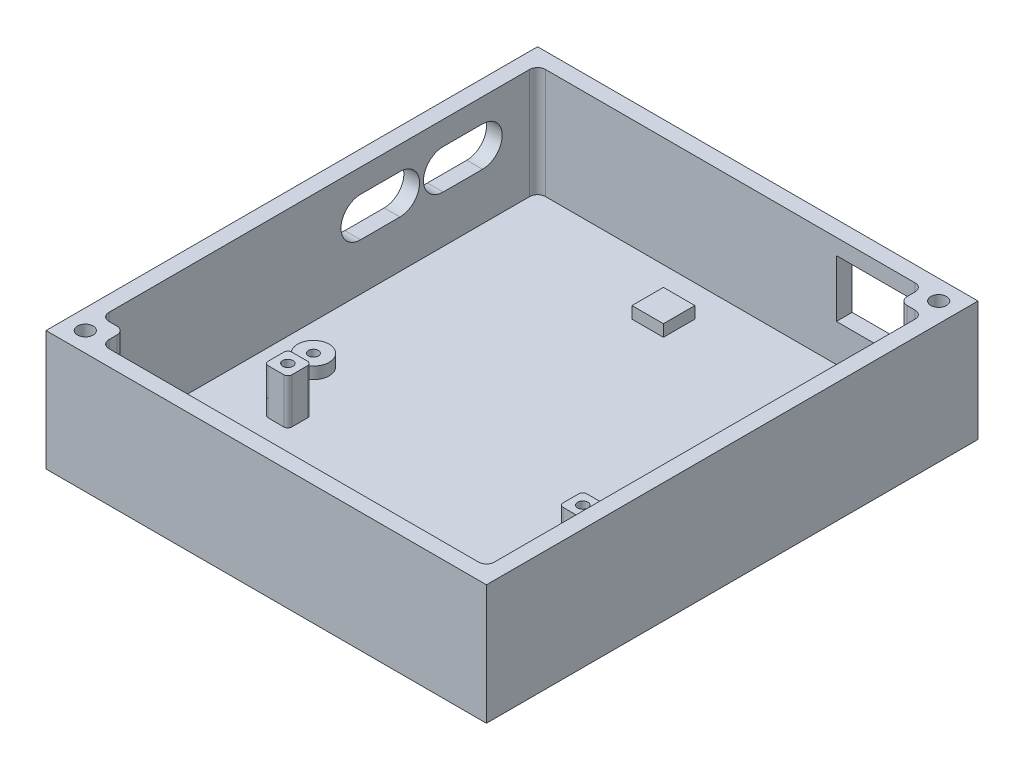
from build123d import *

# Parameters (mm, degrees)
SKETCH1_W           = 112
SKETCH1_H           = 125
BOSS_EXTRUDE1_DEPTH = 2.5
SKETCH2_W           = 112
SKETCH2_H           = 125
SKETCH2_R           = 2
BOSS_EXTRUDE2_DEPTH = 10
SKETCH3_W           = 6
SKETCH3_H           = 6
SKETCH3_R           = 1.3
BOSS_EXTRUDE3_DEPTH = 11.5
SKETCH5_R           = 4
SKETCH5_R_2         = 1.25
SKETCH5_W           = 8
SKETCH5_H           = 8
BOSS_EXTRUDE4_DEPTH = 3
SKETCH6_W           = 6
SKETCH6_H           = 6
SKETCH6_R           = 1.3
BOSS_EXTRUDE5_DEPTH = 6.3
SKETCH7_W           = 112
SKETCH7_H           = 125
SKETCH7_R           = 2
BOSS_EXTRUDE6_DEPTH = 18
CUT_EXTRUDE1_REACH  = 133.835
CUT_EXTRUDE2_REACH  = 142.326
SKETCH10_W          = 18
SKETCH10_H          = 14.5
FILLET1_R           = 2
FILLET3_R           = 1


with BuildPart() as part:
    # Sketch1 → Boss-Extrude1 (new body)
    with BuildSketch(Plane(origin=(0, 0, 0), x_dir=(1, 0, 0), z_dir=(0, 1, 0))):
        Rectangle(SKETCH1_W, SKETCH1_H)
    extrude(amount=BOSS_EXTRUDE1_DEPTH)

    # Sketch2 → Boss-Extrude2 (add)
    with BuildSketch(Plane(origin=(0, 2.5, 0), x_dir=(1, 0, 0), z_dir=(0, 1, 0))):
        Rectangle(SKETCH2_W, SKETCH2_H)
        Polygon((46, 52.5), (52, 52.5), (52, -58.5), (-46, -58.5), (-46, -52.5), (-52, -52.5), (-52, 58.5), (46, 58.5), align=None, mode=Mode.SUBTRACT)
        with Locations((51, 57.5)):
            Circle(SKETCH2_R, mode=Mode.SUBTRACT)
        with Locations((-51, -57.5)):
            Circle(SKETCH2_R, mode=Mode.SUBTRACT)
    extrude(amount=BOSS_EXTRUDE2_DEPTH)

    # Sketch3 → Boss-Extrude3 (add)
    # profile 1 of 4: a face of its own
    with BuildSketch(Plane(origin=(0, 2.5, 0), x_dir=(1, 0, 0), z_dir=(0, 1, 0))):
        with Locations((-34.5, -22.5)):
            Rectangle(SKETCH3_W, SKETCH3_H)
        with Locations((-34.5, -22.5)):
            Circle(SKETCH3_R, mode=Mode.SUBTRACT)
    # profile 2 of 4: a face of its own
    with BuildSketch(Plane(origin=(0, 2.5, 0), x_dir=(1, 0, 0), z_dir=(0, 1, 0))):
        with Locations((40.5, -22.5)):
            Rectangle(SKETCH3_W, SKETCH3_H)
        with Locations((40.5, -22.5)):
            Circle(SKETCH3_R, mode=Mode.SUBTRACT)
    # profile 3 of 4: a face of its own
    with BuildSketch(Plane(origin=(0, 2.5, 0), x_dir=(1, 0, 0), z_dir=(0, 1, 0))):
        with Locations((-34.5, -53.5)):
            Rectangle(SKETCH3_W, SKETCH3_H)
        with Locations((-34.5, -53.5)):
            Circle(SKETCH3_R, mode=Mode.SUBTRACT)
    # profile 4 of 4: a face of its own
    with BuildSketch(Plane(origin=(0, 2.5, 0), x_dir=(1, 0, 0), z_dir=(0, 1, 0))):
        with Locations((40.5, -53.5)):
            Rectangle(SKETCH3_W, SKETCH3_H)
        with Locations((40.5, -53.5)):
            Circle(SKETCH3_R, mode=Mode.SUBTRACT)
    extrude(amount=BOSS_EXTRUDE3_DEPTH)

    # Sketch5 → Boss-Extrude4 (add)
    # profile 1 of 3: a face of its own
    with BuildSketch(Plane(origin=(0, 2.5, 0), x_dir=(1, 0, 0), z_dir=(0, 1, 0))):
        with Locations((-42, -8.5)):
            Circle(SKETCH5_R)
        with Locations((-42, -8.5)):
            Circle(SKETCH5_R_2, mode=Mode.SUBTRACT)
    # profile 2 of 3: a face of its own
    with BuildSketch(Plane(origin=(0, 2.5, 0), x_dir=(1, 0, 0), z_dir=(0, 1, 0))):
        with Locations((38, -8.5)):
            Circle(SKETCH5_R)
        with Locations((38, -8.5)):
            Circle(SKETCH5_R_2, mode=Mode.SUBTRACT)
    # profile 3 of 3: a face of its own
    with BuildSketch(Plane(origin=(0, 2.5, 0), x_dir=(1, 0, 0), z_dir=(0, 1, 0))):
        with Locations((-8, 46.5)):
            Rectangle(SKETCH5_W, SKETCH5_H)
    extrude(amount=BOSS_EXTRUDE4_DEPTH)

    # Sketch6 → Boss-Extrude5 (add)
    # profile 1 of 3: a face of its own
    with BuildSketch(Plane(origin=(0, 14, 0), x_dir=(1, 0, 0), z_dir=(0, 1, 0))):
        with Locations((-34.5, -53.5)):
            Rectangle(SKETCH6_W, SKETCH6_H)
        with Locations((-34.5, -53.5)):
            Circle(SKETCH6_R, mode=Mode.SUBTRACT)
    # profile 2 of 3: a face of its own
    with BuildSketch(Plane(origin=(0, 14, 0), x_dir=(1, 0, 0), z_dir=(0, 1, 0))):
        with Locations((40.5, -22.5)):
            Rectangle(SKETCH6_W, SKETCH6_H)
        with Locations((40.5, -22.5)):
            Circle(SKETCH6_R, mode=Mode.SUBTRACT)
    # profile 3 of 3: a face of its own
    with BuildSketch(Plane(origin=(0, 14, 0), x_dir=(1, 0, 0), z_dir=(0, 1, 0))):
        with Locations((40.5, -53.5)):
            Rectangle(SKETCH6_W, SKETCH6_H)
        with Locations((40.5, -53.5)):
            Circle(SKETCH6_R, mode=Mode.SUBTRACT)
    extrude(amount=BOSS_EXTRUDE5_DEPTH)

    # Sketch7 → Boss-Extrude6 (add)
    with BuildSketch(Plane(origin=(0, 12.5, 0), x_dir=(1, 0, 0), z_dir=(0, 1, 0))):
        Rectangle(SKETCH7_W, SKETCH7_H)
        with Locations((-51, -57.5)):
            Circle(SKETCH7_R, mode=Mode.SUBTRACT)
        Polygon((46, 58.5), (46, 52.5), (52, 52.5), (52, -58.5), (-46, -58.5), (-46, -52.5), (-52, -52.5), (-52, 58.5), align=None, mode=Mode.SUBTRACT)
        with Locations((51, 57.5)):
            Circle(SKETCH7_R, mode=Mode.SUBTRACT)
    extrude(amount=BOSS_EXTRUDE6_DEPTH)

    # Sketch9 → Cut-Extrude1 (cut, up to next)
    with BuildSketch(Plane.ZY.offset(56), mode=Mode.PRIVATE) as cut_extrude1_sk1:
        with BuildLine():
            Line((-44.5, 24.5), (-34.5, 24.5))
            ThreePointArc((-34.5, 24.5), (-29.5, 19.5), (-34.5, 14.5))
            Line((-34.5, 14.5), (-44.5, 14.5))
            ThreePointArc((-44.5, 14.5), (-49.5, 19.5), (-44.5, 24.5))
        make_face()
    cut_extrude1_tool1 = extrude(cut_extrude1_sk1.sketch, amount=-CUT_EXTRUDE1_REACH, mode=Mode.PRIVATE) & part.part
    # Sketch9 → Cut-Extrude1 (cut, up to next)
    with BuildSketch(Plane.ZY.offset(56), mode=Mode.PRIVATE) as cut_extrude1_sk2:
        with BuildLine():
            Line((-23.5, 24.5), (-13.5, 24.5))
            ThreePointArc((-13.5, 24.5), (-8.5, 19.5), (-13.5, 14.5))
            Line((-13.5, 14.5), (-23.5, 14.5))
            ThreePointArc((-23.5, 14.5), (-28.5, 19.5), (-23.5, 24.5))
        make_face()
    cut_extrude1_tool2 = extrude(cut_extrude1_sk2.sketch, amount=-CUT_EXTRUDE1_REACH, mode=Mode.PRIVATE) & part.part
    add(cut_extrude1_tool1.solids().sort_by_distance((-56, 19.5, -39.5))[0], mode=Mode.SUBTRACT)
    add(cut_extrude1_tool2.solids().sort_by_distance((-56, 19.5, -18.5))[0], mode=Mode.SUBTRACT)

    # Sketch10 → Cut-Extrude2 (cut, up to next)
    with BuildSketch(Plane(origin=(0, 0, -62.5), x_dir=(-1, 0, 0), z_dir=(0, 0, -1)), mode=Mode.PRIVATE) as cut_extrude2_sk1:
        with Locations((-33, 19.25)):
            Rectangle(SKETCH10_W, SKETCH10_H)
    cut_extrude2_tool1 = extrude(cut_extrude2_sk1.sketch, amount=-CUT_EXTRUDE2_REACH, mode=Mode.PRIVATE) & part.part
    add(cut_extrude2_tool1.solids().sort_by_distance((33, 19.25, -62.5))[0], mode=Mode.SUBTRACT)

    # Fillet1
    fillet1_edges = [part.edges().sort_by_distance(p)[0] for p in [
        (-46, 16.5, 52.5),
        (46, 16.5, -52.5),
        (52, 16.5, 58.5),
        (-52, 16.5, -58.5),
        (-46, 16.5, 58.5),
        (-52, 16.5, 52.5),
        (52, 16.5, -52.5),
        (46, 16.5, -58.5),
    ]]
    fillet(fillet1_edges, radius=FILLET1_R)

    # Fillet3
    fillet3_edges = [part.edges().sort_by_distance(p)[0] for p in [
        (43.5, 11.4, 25.5),
        (43.5, 11.4, 56.5),
        (-31.5, 11.4, 56.5),
        (-31.5, 11.4, 50.5),
        (-37.5, 11.4, 50.5),
        (-37.5, 11.4, 56.5),
        (37.5, 11.4, 56.5),
        (37.5, 11.4, 50.5),
        (43.5, 11.4, 50.5),
        (37.5, 11.4, 25.5),
        (43.5, 11.4, 19.5),
        (37.5, 11.4, 19.5),
        (-31.5, 8.25, 19.5),
        (-37.5, 8.25, 19.5),
        (-37.5, 8.25, 25.5),
        (-31.5, 8.25, 25.5),
    ]]
    fillet(fillet3_edges, radius=FILLET3_R)


solid = part.part
